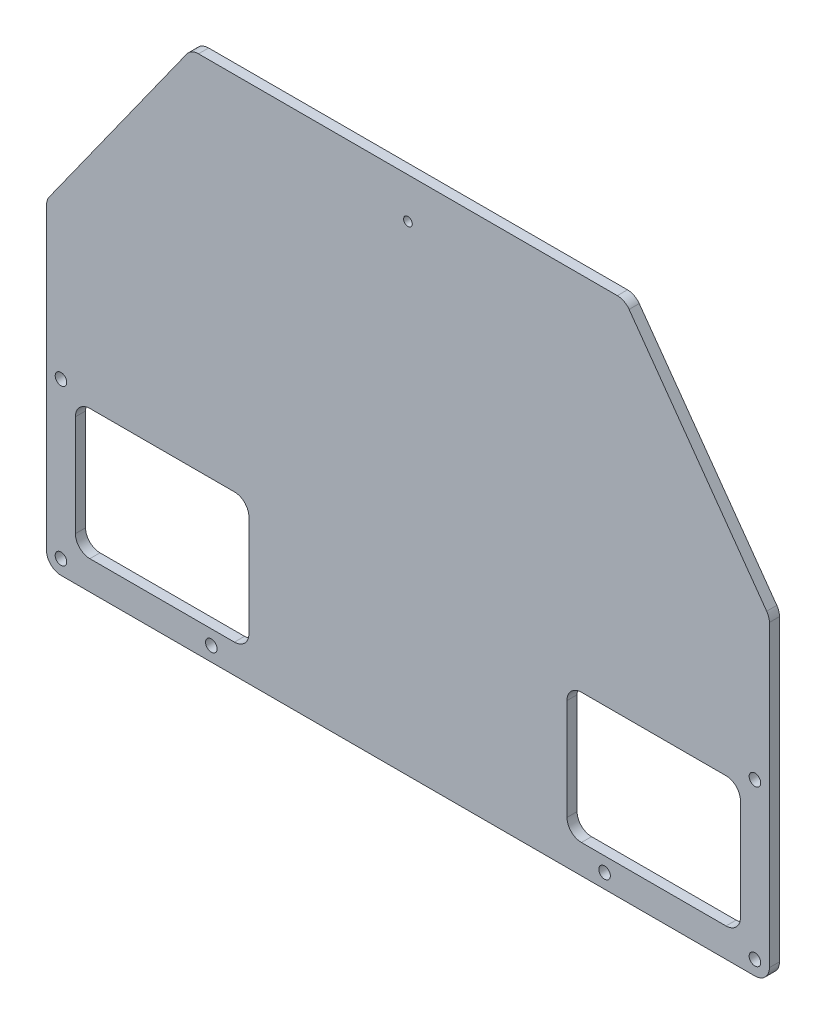
from build123d import *

# Parameters (mm, degrees)
BOSS_EXTRU_1_DEPTH           = 3.5
ESQUISSE2_R                  = 2
ENL_V_MAT_EXTRU_1_DEPTH      = 395.382111663
ESQUISSE3_R                  = 2
ENL_V_MAT_EXTRU_2_DEPTH      = 395.382111663
ENL_V_MAT_EXTRU_3_DEPTH      = 395.382111663
ENL_V_MAT_EXTRU_4_DEPTH      = 395.382111663
ENL_V_MAT_EXTRU_4_DEPTH_BACK = 395.382111663
ESQUISSE6_R                  = 1.5
ENL_V_MAT_EXTRU_5_DEPTH      = 309.078317965
CONG_1_R                     = 5


with BuildPart() as part:
    # Esquisse1 → Boss.-Extru.1 (new body)
    with BuildSketch(Plane.XY):
        with BuildLine():
            Line((5, 0), (245, 0))
            ThreePointArc((245, 0), (248.535533906, 1.464466094), (250, 5))
            Line((250, 5), (250, 305))
            Line((250, 305), (0, 305))
            Line((0, 305), (0, 5))
            ThreePointArc((0, 5), (1.464466094, 1.464466094), (5, 0))
        make_face()
    extrude(amount=BOSS_EXTRU_1_DEPTH)

    # Esquisse2 → Enlèv. mat.-Extru.1 (cut, through all)
    with BuildSketch(Plane.XY.offset(3.5)):
        with Locations((5, 5)):
            Circle(ESQUISSE2_R)
        with Locations((245, 5)):
            Circle(ESQUISSE2_R)
        with Locations((5, 58.8)):
            Circle(ESQUISSE2_R)
        with Locations((245, 58.8)):
            Circle(ESQUISSE2_R)
    extrude(amount=-ENL_V_MAT_EXTRU_1_DEPTH, mode=Mode.SUBTRACT)

    # Esquisse3 → Enlèv. mat.-Extru.2 (cut, through all)
    with BuildSketch(Plane.XY.offset(3.5)):
        with Locations((57, 5)):
            Circle(ESQUISSE3_R)
        with Locations((193, 5)):
            Circle(ESQUISSE3_R)
    extrude(amount=-ENL_V_MAT_EXTRU_2_DEPTH, mode=Mode.SUBTRACT)

    # Esquisse4 → Enlèv. mat.-Extru.3 (cut, through all)
    with BuildSketch(Plane(origin=(0, 0, 0), x_dir=(-1, 0, 0), z_dir=(0, 0, -1))):
        with BuildLine():
            Line((-70, 15), (-70, 50))
            ThreePointArc((-70, 50), (-68.535533906, 53.535533906), (-65, 55))
            Line((-65, 55), (-15, 55))
            ThreePointArc((-15, 55), (-11.464466094, 53.535533906), (-10, 50))
            Line((-10, 50), (-10, 15))
            ThreePointArc((-10, 15), (-11.464466094, 11.464466094), (-15, 10))
            Line((-15, 10), (-65, 10))
            ThreePointArc((-65, 10), (-68.535533906, 11.464466094), (-70, 15))
        make_face()
        with BuildLine():
            Line((-185, 10), (-235, 10))
            ThreePointArc((-235, 10), (-238.535533906, 11.464466094), (-240, 15))
            Line((-240, 15), (-240, 50))
            ThreePointArc((-240, 50), (-238.535533906, 53.535533906), (-235, 55))
            Line((-235, 55), (-185, 55))
            ThreePointArc((-185, 55), (-181.464466094, 53.535533906), (-180, 50))
            Line((-180, 50), (-180, 15))
            ThreePointArc((-180, 15), (-181.464466094, 11.464466094), (-185, 10))
        make_face()
    extrude(amount=-ENL_V_MAT_EXTRU_3_DEPTH, mode=Mode.SUBTRACT)

    # Esquisse5 → Enlèv. mat.-Extru.4 (cut, two sides: drawn at the far end of the back side and taken through both)
    with BuildSketch(Plane.XY.offset(3.5).offset(-ENL_V_MAT_EXTRU_4_DEPTH_BACK)):
        Polygon((-374.383398967, -414.136758554), (0, 110), (50, 180), (200, 180), (250, 110), (624.383398967, -414.136758554), (624.383398967, 874.090350445), (-374.383398967, 874.090350445), align=None)
    extrude(amount=ENL_V_MAT_EXTRU_4_DEPTH + ENL_V_MAT_EXTRU_4_DEPTH_BACK, mode=Mode.SUBTRACT)

    # Esquisse6 → Enlèv. mat.-Extru.5 (cut, through all)
    with BuildSketch(Plane.XY.offset(3.5)):
        with Locations((125, 166)):
            Circle(ESQUISSE6_R)
    extrude(amount=-ENL_V_MAT_EXTRU_5_DEPTH, mode=Mode.SUBTRACT)

    # Congé1
    cong_1_edges = [part.edges().sort_by_distance(p)[0] for p in [
        (250, 110, 1.75),
        (200, 180, 1.75),
        (50, 180, 1.75),
        (0, 110, 1.75),
    ]]
    fillet(cong_1_edges, radius=CONG_1_R)


solid = part.part
